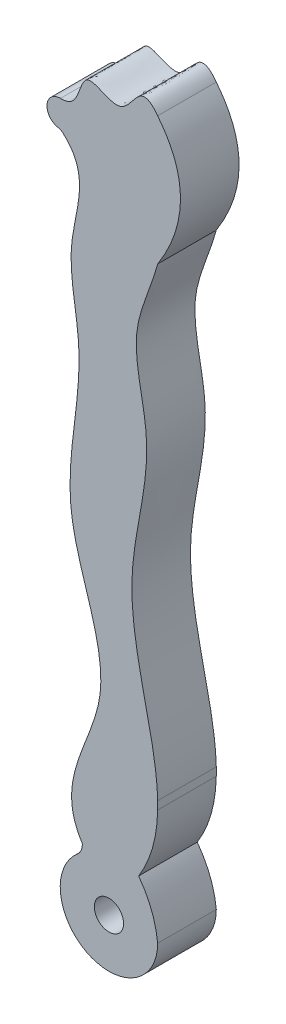
from build123d import *

# Parameters (mm, degrees)
SKETCH1_R           = 1.5
BOSS_EXTRUDE1_DEPTH = 6
SKETCH3_W           = 6
SKETCH3_H           = 19.728320027
SKETCH3_H_2         = 60.271679973
BOSS_EXTRUDE2_DEPTH = 10
SKETCH4_W           = 9.051057065
SKETCH4_H           = 6
CUT_EXTRUDE1_DEPTH  = 162
SKETCH5_W           = 2.776805371
SKETCH5_H           = 7.673994378
CUT_EXTRUDE2_DEPTH  = 162
SKETCH6_W           = 9.98
SKETCH6_H           = 6
BOSS_EXTRUDE3_DEPTH = 10
BOSS_EXTRUDE4_DEPTH = 6
CUT_EXTRUDE4_DEPTH  = 6
CUT_EXTRUDE5_DEPTH  = 6
FILLET1_START       = -1
FILLET1_DEPTH       = 8
SKETCH10_W          = 9.98
SKETCH10_H          = 70
BOSS_EXTRUDE6_DEPTH = 6
SKETCH11_W          = 8.360204963
SKETCH11_H          = 23.264362874
CUT_EXTRUDE6_DEPTH  = 47
BOSS_EXTRUDE8_DEPTH = 6
CUT_EXTRUDE7_DEPTH  = 6
CUT_EXTRUDE8_START  = -6
CUT_EXTRUDE8_DEPTH  = 6
SKETCH15_R          = 1.359337551
BOSS_EXTRUDE9_DEPTH = 6
FILLET2_R           = 1


with BuildPart() as part:
    # Sketch1 → Boss-Extrude1 (new body)
    with BuildSketch(Plane.XY):
        with BuildLine():
            Line((0, 0), (0, -9.98))
            Line((0, -9.98), (9.98, -9.98))
            Line((9.98, -9.98), (9.98, 0))
            add(Edge.make_bspline(
                [(0, 54.250736404), (-1.3001908, 57.732186027), (3.264697289, 54.364229546), (2.426320397, 59.671317952), (6.24965715, 57.931332096), (7.559999273, 60.308317398), (10.808963849, 60.427698471), (10.337139395, 56.901907174), (8.667893464, 54.394927102), (7.624843251, 50.040394793), (9.267984866, 44.554889548), (7.046090887, 37.973638675), (9.84685356, 30.217018819), (6.270285073, 21.673277978), (10.793667439, 11.106885954), (4.474903421, 3.416500301), (9.98, 0)],
                knots=[0, 0, 0, 0, 0.053422047, 0.084053188, 0.123826292, 0.153487584, 0.181182143, 0.220513, 0.254555574, 0.310198036, 0.38825613, 0.476667751, 0.573339812, 0.700293064, 0.81918735, 1, 1, 1, 1], degree=3))
            add(Edge.make_bspline(
                [(0, 54.250736404), (5.084395927, 51.698919308), (-1.040481835, 45.991903649), (5.447322124, 39.887247803), (0.909066537, 34.169036482), (6.005419265, 27.503354662), (0.487031558, 20.054851145), (5.671743487, 12.84454135), (0.403542473, 6.211235786), (5.177057559, 1.35031129), (0, 0)],
                knots=[0, 0, 0, 0, 0.175024795, 0.269809775, 0.365352016, 0.476782251, 0.63395402, 0.755982767, 0.862891176, 1, 1, 1, 1], degree=3))
        make_face()
        with Locations((4.99, -4.99)):
            Circle(SKETCH1_R, mode=Mode.SUBTRACT)
    extrude(amount=BOSS_EXTRUDE1_DEPTH)

    # Sketch3 → Boss-Extrude2 (add)
    with BuildSketch(Plane.ZY):
        with Locations((3, 70.135839987)):
            Rectangle(SKETCH3_W, SKETCH3_H)
        with Locations((3, 30.135839987)):
            Rectangle(SKETCH3_W, SKETCH3_H_2)
    extrude(amount=-BOSS_EXTRUDE2_DEPTH)

    # Sketch4 → Cut-Extrude1 (cut)
    with BuildSketch(Plane.XZ):
        with Locations((14.505528533, 3)):
            Rectangle(SKETCH4_W, SKETCH4_H)
    extrude(amount=-CUT_EXTRUDE1_DEPTH, mode=Mode.SUBTRACT)

    # Sketch5 → Cut-Extrude2 (cut)
    with BuildSketch(Plane.XZ.offset(9.98)):
        with Locations((-1.388402686, 2.163002811)):
            Rectangle(SKETCH5_W, SKETCH5_H)
    extrude(amount=-CUT_EXTRUDE2_DEPTH, mode=Mode.SUBTRACT)

    # Sketch6 → Boss-Extrude3 (add)
    with BuildSketch(Plane(origin=(0, 80, 0), x_dir=(1, 0, 0), z_dir=(0, 1, 0))):
        with Locations((4.99, -3)):
            Rectangle(SKETCH6_W, SKETCH6_H)
    extrude(amount=BOSS_EXTRUDE3_DEPTH)

    # Sketch7 → Boss-Extrude4 (add)
    with BuildSketch(Plane.XY.offset(6)):
        with BuildLine():
            Line((0, 0), (9.98, 0))
            add(Edge.make_bspline(
                [(0, 83.724231828), (-3.860120501, 87.893159061), (1.875984915, 85.269985621), (3.67621996, 90.493946858), (6.74031748, 87.256477942), (10.910791453, 91.330502674), (6.94132405, 80.93059981), (8.63400219, 74.989003981), (8.904822247, 63.614217887), (4.761347691, 53.094578021), (11.070596211, 39.679531964), (2.06869458, 25.535490062), (12.628458408, 9.599332358), (1.827356394, 2.776036691), (9.98, 0)],
                knots=[0, 0, 0, 0, 0.06130885, 0.083016766, 0.115331592, 0.138604375, 0.192961713, 0.27875924, 0.366903135, 0.489663243, 0.583584237, 0.749388452, 0.899317268, 1, 1, 1, 1], degree=3))
            add(Edge.make_bspline(
                [(0, 83.724231828), (5.303604513, 79.627551199), (-1.724082843, 71.171061089), (3.506871724, 61.210633208), (1.012601117, 51.32037438), (2.484565744, 41.12836032), (3.801376789, 29.33837591), (-1.788318883, 20.592225029), (3.990043149, 11.280963243), (3.127348918, 3.88723838), (0, 0)],
                knots=[0, 0, 0, 0, 0.178407716, 0.282250633, 0.360012872, 0.523096627, 0.638532862, 0.770288181, 0.82976307, 1, 1, 1, 1], degree=3))
        make_face()
    extrude(amount=-BOSS_EXTRUDE4_DEPTH)

    # Sketch8 → Cut-Extrude4 (cut)
    with BuildSketch(Plane.XY):
        with BuildLine():
            Line((-20.353011205, 0), (0, 0))
            add(Edge.make_bspline(
                [(0, 83.724231828), (5.303604513, 79.627551199), (-1.724082843, 71.171061089), (3.506871724, 61.210633208), (1.012601117, 51.32037438), (2.484565744, 41.12836032), (3.801376789, 29.33837591), (-1.788318883, 20.592225029), (3.990043149, 11.280963243), (3.127348918, 3.88723838), (0, 0)],
                knots=[0, 0, 0, 0, 0.178407716, 0.282250633, 0.360012872, 0.523096627, 0.638532862, 0.770288181, 0.82976307, 1, 1, 1, 1], degree=3))
            add(Edge.make_bspline(
                [(0, 83.724231828), (-3.860120501, 87.893159061), (1.875984915, 85.269985621), (3.67621996, 90.493946858), (6.74031748, 87.256477942), (10.910791453, 91.330502674), (6.94132405, 80.93059981), (8.63400219, 74.989003981), (8.904822247, 63.614217887), (4.761347691, 53.094578021), (11.070596211, 39.679531964), (2.06869458, 25.535490062), (12.628458408, 9.599332358), (1.827356394, 2.776036691), (9.98, 0)],
                knots=[0, 0, 0, 0, 0.06130885, 0.083016766, 0.115331592, 0.138604375, 0.192961713, 0.27875924, 0.366903135, 0.489663243, 0.583584237, 0.749388452, 0.899317268, 1, 1, 1, 1], degree=3))
            Line((9.98, 0), (9.98, 96.522655466))
            Line((9.98, 96.522655466), (-20.353011205, 96.522655466))
            Line((-20.353011205, 96.522655466), (-20.353011205, 0))
        make_face()
    extrude(amount=CUT_EXTRUDE4_DEPTH, mode=Mode.SUBTRACT)

    # Sketch9 → Cut-Extrude5 (cut)
    with BuildSketch(Plane(origin=(0, 0, 0), x_dir=(-1, 0, 0), z_dir=(0, 0, -1))):
        with BuildLine():
            ThreePointArc((-4.99, -9.98), (-8.518462838, -8.518462838), (-9.98, -4.99))
            Line((-9.98, -4.99), (-9.98, -9.98))
            Line((-9.98, -9.98), (-4.99, -9.98))
        make_face()
        with BuildLine():
            Line((0, -9.98), (0, -4.99))
            ThreePointArc((0, -4.99), (-1.461537162, -8.518462838), (-4.99, -9.98))
            Line((-4.99, -9.98), (0, -9.98))
        make_face()
    extrude(amount=-CUT_EXTRUDE5_DEPTH, mode=Mode.SUBTRACT)

    # Fillet1: read off the stored shape, not the designer's step
    # Fillet1 outline → Fillet1 (cut)
    with BuildSketch(Plane.XY.offset(FILLET1_START)):
        with BuildLine():
            add(Edge.make_bspline(
                [(9.98, 0), (8.218626493, 0.599760976), (7.040344633, 1.197898042), (6.291253035, 1.799266729)],
                knots=[0, 0, 0, 0, 0.021752441, 0.021752441, 0.021752441, 0.021752441], degree=3))
            ThreePointArc((6.291253035, 1.799266729), (8.817837972, -1.22470725), (9.98, -4.99))
            Line((9.98, -4.99), (9.98, 0))
        make_face()
        with BuildLine():
            ThreePointArc((0, -2.973337376), (0.315821695, -0.480008166), (1.24333811, 1.855831552))
            add(Edge.make_bspline(
                [(1.24333811, 1.855831552), (0.885295295, 1.206597716), (0.470846329, 0.585253507), (0, 0)],
                knots=[0.974369526, 0.974369526, 0.974369526, 0.974369526, 1, 1, 1, 1], degree=3))
            Line((0, 0), (0, -2.973337376))
        make_face()
    extrude(amount=FILLET1_DEPTH, mode=Mode.SUBTRACT)

    # Sketch10 → Boss-Extrude6 (add)
    with BuildSketch(Plane.XY.offset(6)):
        with Locations((4.99, 35)):
            Rectangle(SKETCH10_W, SKETCH10_H)
    extrude(amount=-BOSS_EXTRUDE6_DEPTH)

    # Sketch11 → Cut-Extrude6 (cut)
    with BuildSketch(Plane(origin=(9.98, 0, 0), x_dir=(0, 0, -1), z_dir=(1, 0, 0))):
        with Locations((-1.819897518, 81.632181437)):
            Rectangle(SKETCH11_W, SKETCH11_H)
    extrude(amount=-CUT_EXTRUDE6_DEPTH, mode=Mode.SUBTRACT)

    # Sketch12 → Boss-Extrude8 (add)
    with BuildSketch(Plane.XY.offset(6)):
        with BuildLine():
            add(Edge.make_bspline(
                [(0, 62.232441795), (3.366076975, 59.630380754), (-0.073151125, 53.02494966), (3.175092228, 41.835967984), (-1.206007011, 28.711590807), (7.609817179, 13.998261114), (-0.756937769, 4.621639786), (2.258965047, 0)],
                knots=[0, 0, 0, 0, 0.161604227, 0.294432119, 0.536766493, 0.773956454, 1, 1, 1, 1], degree=3))
            Line((2.258965047, 0), (4.99, 0))
            Line((4.99, 0), (8.031933656, 0))
            add(Edge.make_bspline(
                [(9.98, 6.82520611), (9.926299411, 4.506985086), (9.404623277, 2.221515067), (8.031933656, 0)],
                knots=[0.918733917, 0.918733917, 0.918733917, 0.918733917, 1, 1, 1, 1], degree=3))
            Line((9.98, 6.82520611), (9.98, 7.651273388))
            add(Edge.make_bspline(
                [(9.98, 55.243355998), (9.346010273, 52.80487071), (6.653585039, 47.837452892), (10.19689852, 37.862166444), (6.24168999, 27.042244628), (8.545471612, 16.440100286), (9.9219389, 10.252639566), (9.98, 7.651273388)],
                knots=[0.357225348, 0.357225348, 0.357225348, 0.357225348, 0.442609394, 0.54131583, 0.695856348, 0.818192307, 0.909096758, 0.909096758, 0.909096758, 0.909096758], degree=3))
            Line((9.98, 55.243355998), (9.98, 68.36908596))
            add(Edge.make_bspline(
                [(0, 64.951116897), (0.43908596, 64.94490096), (1.94117936, 65.218326644), (2.170389448, 69.524442473), (6.334225332, 65.880314158), (8.080186117, 70.117581647), (9.460664886, 69.117995192), (9.98, 68.36908596)],
                knots=[0.062932127, 0.062932127, 0.062932127, 0.062932127, 0.076761965, 0.113053263, 0.151244453, 0.185874876, 0.21292473, 0.21292473, 0.21292473, 0.21292473], degree=3))
            Line((0, 64.951116897), (0, 62.232441795))
        make_face()
    extrude(amount=-BOSS_EXTRUDE8_DEPTH)

    # Sketch13 → Cut-Extrude7 (cut)
    with BuildSketch(Plane.XY):
        with BuildLine():
            Line((0, 74.736193975), (0, 64.951116897))
            add(Edge.make_bspline(
                [(0, 64.951116897), (0.43908596, 64.94490096), (1.94117936, 65.218326644), (2.170389448, 69.524442473), (6.334225332, 65.880314158), (8.750906154, 71.745350286), (11.637080834, 65.766469524), (10.6270973, 61.090630427), (10.698574131, 55.300297407), (6.653585039, 47.837452892), (10.19689852, 37.862166444), (6.24168999, 27.042244628), (9.114889987, 13.819601997), (11.102901563, 4.96995196), (8.031933656, 0)],
                knots=[0.062932127, 0.062932127, 0.062932127, 0.062932127, 0.076761965, 0.113053263, 0.151244453, 0.185874876, 0.25129088, 0.26474585, 0.357225348, 0.442609394, 0.54131583, 0.695856348, 0.818192307, 1, 1, 1, 1], degree=3))
            Line((8.031933656, 0), (9.98, 0))
            Line((9.98, 0), (16.816025852, 0))
            Line((16.816025852, 0), (16.816025852, 74.736193975))
            Line((16.816025852, 74.736193975), (0, 74.736193975))
        make_face()
        with BuildLine():
            Line((-8.191722038, 0), (0, 0))
            Line((0, 0), (0, 62.232441795))
            add(Edge.make_bspline(
                [(0, 62.232441795), (-4.505800258, 66.698633136), (-1.998043064, 64.979402269), (0, 64.951116897)],
                knots=[0, 0, 0, 0, 0.062932127, 0.062932127, 0.062932127, 0.062932127], degree=3))
            Line((0, 64.951116897), (0, 74.736193975))
            Line((0, 74.736193975), (-8.191722038, 74.736193975))
            Line((-8.191722038, 74.736193975), (-8.191722038, 0))
        make_face()
        with BuildLine():
            Line((0, 62.232441795), (0, 0))
            Line((0, 0), (2.258965047, 0))
            add(Edge.make_bspline(
                [(0, 62.232441795), (3.366076975, 59.630380754), (-0.073151125, 53.02494966), (3.175092228, 41.835967984), (-1.206007011, 28.711590807), (7.609817179, 13.998261114), (-0.756937769, 4.621639786), (2.258965047, 0)],
                knots=[0, 0, 0, 0, 0.161604227, 0.294432119, 0.536766493, 0.773956454, 1, 1, 1, 1], degree=3))
        make_face()
        with BuildLine():
            ThreePointArc((4.99, -9.98), (1.461537162, -8.518462838), (0, -4.99))
            Line((0, -4.99), (0, -9.98))
            Line((0, -9.98), (4.99, -9.98))
        make_face()
        with BuildLine():
            ThreePointArc((9.98, -4.99), (8.518462838, -8.518462838), (4.99, -9.98))
            Line((4.99, -9.98), (9.98, -9.98))
            Line((9.98, -9.98), (9.98, -4.99))
        make_face()
    extrude(amount=CUT_EXTRUDE7_DEPTH, mode=Mode.SUBTRACT)

    # Sketch14 → Cut-Extrude8 (cut)
    with BuildSketch(Plane.XY.offset(6).offset(CUT_EXTRUDE8_START)):
        with BuildLine():
            Line((2.258965047, 0), (0.452263889, 0))
            ThreePointArc((0.452263889, 0), (0.26459824, -0.688178176), (0.126467055, -1.387983415))
            ThreePointArc((0.126467055, -1.387983415), (0.966028302, -1.538822337), (1.747558201, -1.197023441))
            ThreePointArc((1.747558201, -1.197023441), (2.126660381, -0.695865796), (2.261262104, -0.082058152))
            ThreePointArc((2.261262104, -0.082058152), (2.260687727, -0.041013004), (2.258965047, 0))
        make_face()
        with BuildLine():
            ThreePointArc((1.747558201, -1.197023441), (0.966028302, -1.538822337), (0.126467055, -1.387983415))
            ThreePointArc((0.126467055, -1.387983415), (0.031666903, -2.178142259), (0, -2.973337376))
            Line((0, -2.973337376), (0, -4.99))
            ThreePointArc((0, -4.99), (0.457898689, -2.901900934), (1.747558201, -1.197023441))
        make_face()
    extrude(amount=CUT_EXTRUDE8_DEPTH, mode=Mode.SUBTRACT)

    # Sketch15 → Boss-Extrude9 (add)
    with BuildSketch(Plane.XY.offset(6)):
        with Locations((0, 63.591779346)):
            Circle(SKETCH15_R)
        with BuildLine():
            Line((9.98, 68.36908596), (9.98, 55.243355999))
            add(Edge.make_bspline(
                [(9.98, 68.36908596), (14.64685957, 62.567397022), (9.98, 55.243355999)],
                knots=[0, 0, 0, 1, 1, 1], degree=2))
        make_face()
    extrude(amount=-BOSS_EXTRUDE9_DEPTH)

    # Fillet2
    fillet2_edges = [part.edges().sort_by_distance(p)[0] for p in [
        (0, 62.232441795, 3),
    ]]
    fillet(fillet2_edges, radius=FILLET2_R)


solid = part.part
